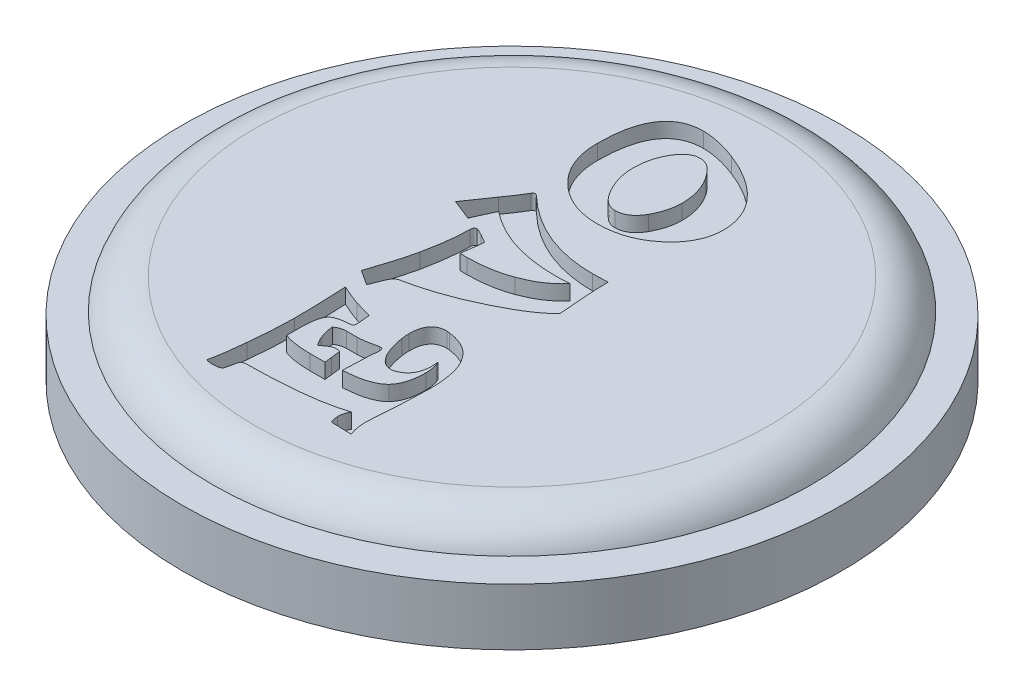
from build123d import *

# Parameters (mm, degrees)
SKETCH1_R           = 17.3
BOSS_EXTRUDE1_DEPTH = 4
SKETCH2_R           = 20
BOSS_EXTRUDE2_DEPTH = 2
CHAMFER1_SIZE       = 0.5
CHAMFER1_SIZE2      = 1.37373871
SKETCH4_R           = 21
SKETCH4_R_2         = 17.8
BOSS_EXTRUDE4_DEPTH = 3.6
FILLET1_R           = 3
CUT_EXTRUDE1_START  = -1
CUT_EXTRUDE1_DEPTH  = 1
BOSS_EXTRUDE5_START = 0.2
SKETCH5_R           = 22
SKETCH5_R_2         = 18.3
BOSS_EXTRUDE5_DEPTH = 3.8


# Read off the part's stored shape, not the designer's step: Cut-Extrude1
with BuildPart() as part:
    # Sketch1 → Boss-Extrude1 (new body)
    with BuildSketch(Plane(origin=(0, 0, 0), x_dir=(1, 0, 0), z_dir=(0, 1, 0))):
        with Locations(Location((0, 0, 0), (0, 0, 270))):
            Circle(SKETCH1_R)
    extrude(amount=BOSS_EXTRUDE1_DEPTH)

    # Sketch2 → Boss-Extrude2 (add)
    with BuildSketch(Plane(origin=(0, 4, 0), x_dir=(1, 0, 0), z_dir=(0, 1, 0))):
        with Locations(Location((0, 0, 0), (0, 0, 270))):
            Circle(SKETCH2_R)
    extrude(amount=BOSS_EXTRUDE2_DEPTH)

    # Chamfer1
    chamfer1_edges = [part.edges().sort_by_distance(p)[0] for p in [
        (0, 0, -17.3),
    ]]
    chamfer1_side = [part.faces().sort_by_distance(p)[0] for p in [
        (0, 0, 0),
    ]]
    chamfer(chamfer1_edges, length=CHAMFER1_SIZE, length2=CHAMFER1_SIZE2, reference=chamfer1_side[0])

    # Fillet1
    # the kernel refuses this fillet: 3 mm, written as the material it takes off along each edge
    with BuildSketch(Plane(origin=(0, 6, 0), x_dir=(0, 0, 1), z_dir=(-1, 0, 0))) as fillet1_piece_1:
        with BuildLine():
            CenterArc((17.171572875, -3), FILLET1_R, 19.471220634, 70.528779366)
            Line((17.171572875, 0), (17.171572875, 0.06))
            Line((17.171572875, 0.06), (20, 0.06))
            Line((20, 0.06), (20.06, 0))
            ThreePointArc((20.06, 0), (20.06, -1), (20.056568542, -1.98))
            Line((20.056568542, -1.98), (20, -2))
        make_face()
    revolve(axis=Axis((0, 6, 0), (0, 1, 0)), mode=Mode.SUBTRACT)

    # Cut-Extrude1 outline → Cut-Extrude1 (cut)
    # profile 1 of 3: a face of its own
    with BuildSketch(Plane(origin=(0, 6, 0), x_dir=(1, 0, 0), z_dir=(0, 1, 0)).offset(CUT_EXTRUDE1_START)):
        with BuildLine():
            add(Edge.make_bspline(
                [(-0.168122271, -6.697598253), (-0.167145866, -6.640798599), (-0.165256065, -6.530864577), (-0.151681763, -6.371256134), (-0.131732502, -6.222672194), (-0.099932248, -6.085438859), (-0.060747783, -5.958916209), (-0.014054684, -5.841952862), (0.043667016, -5.736769087), (0.109360202, -5.642700498), (0.183439681, -5.559323391), (0.268191549, -5.489129841), (0.360244475, -5.427197194), (0.462837416, -5.378891365), (0.572833112, -5.338959273), (0.691574959, -5.311560647), (0.818833935, -5.294748275), (0.906603543, -5.293316432), (0.951965066, -5.292576419)],
                knots=[0, 0, 0, 0, 0.082956343, 0.160559504, 0.233852757, 0.301742576, 0.366049731, 0.427199969, 0.485361024, 0.540882594, 0.59451718, 0.647705424, 0.70122135, 0.756138499, 0.812883208, 0.871869129, 0.93377877, 1, 1, 1, 1], degree=3))
            add(Edge.make_bspline(
                [(-0.122270742, -7.229803493), (-0.129038192, -7.179613365), (-0.142040315, -7.083184387), (-0.157223838, -6.944565918), (-0.16560783, -6.817242327), (-0.167307576, -6.736363682), (-0.168122271, -6.697598253)],
                knots=[0, 0, 0, 0, 0.284211338, 0.546047788, 0.782419057, 1, 1, 1, 1], degree=3))
            add(Edge.make_bspline(
                [(0.408296943, -8.816593886), (0.377348289, -8.76743983), (0.313857782, -8.666601326), (0.234105026, -8.501233866), (0.155470952, -8.324694831), (0.088647454, -8.132193498), (0.023200794, -7.927540165), (-0.030699199, -7.707122306), (-0.082786019, -7.473832669), (-0.108908575, -7.312386283), (-0.122270742, -7.229803493)],
                knots=[0, 0, 0, 0, 0.103337097, 0.211993862, 0.326462617, 0.447274087, 0.574531525, 0.708886835, 0.851090274, 1, 1, 1, 1], degree=3))
            add(Edge.make_bspline(
                [(1.263100437, -9.379912664), (1.223046302, -9.378698015), (1.143027908, -9.376271442), (1.026374232, -9.345338752), (0.911398308, -9.304444161), (0.803297215, -9.239586596), (0.696600878, -9.160827738), (0.596940008, -9.061121355), (0.49622725, -8.948162378), (0.438377123, -8.861602304), (0.408296943, -8.816593886)],
                knots=[0, 0, 0, 0, 0.112082108, 0.223912722, 0.336860261, 0.453517341, 0.576059942, 0.70822002, 0.848283921, 1, 1, 1, 1], degree=3))
            add(Edge.make_bspline(
                [(1.584061135, -9.319323144), (1.532149316, -9.337199486), (1.428115859, -9.373024424), (1.318179485, -9.377613499), (1.263100437, -9.379912664)],
                knots=[0, 0, 0, 0, 0.49899158, 1, 1, 1, 1], degree=3))
            add(Edge.make_bspline(
                [(2.478165939, -7.834061135), (2.475271751, -7.92427587), (2.469714149, -8.097511862), (2.429292488, -8.346226212), (2.359022101, -8.570051535), (2.26185114, -8.771194318), (2.13360973, -8.946759667), (1.978328467, -9.099322187), (1.793150515, -9.225861053), (1.655038502, -9.287596554), (1.584061135, -9.319323144)],
                knots=[0, 0, 0, 0, 0.145852043, 0.28007424, 0.405970352, 0.523996811, 0.63963609, 0.755729221, 0.874466411, 1, 1, 1, 1], degree=3))
            add(Edge.make_bspline(
                [(2.454683066, -7.39231115), (2.45485776, -7.396548593), (2.45716925, -7.449422225), (2.465355283, -7.5529269), (2.475942016, -7.695816994), (2.477463178, -7.790375932), (2.478165939, -7.834061135)],
                knots=[0.174865959, 0.174865959, 0.174865959, 0.174865959, 0.198596851, 0.47101008, 0.755612394, 1, 1, 1, 1], degree=3))
            add(Edge.make_bspline(
                [(2.522379913, -7.568777293), (2.50772928, -7.52695538), (2.486825707, -7.467283735), (2.462054932, -7.409671452), (2.454683066, -7.39231115)],
                knots=[0, 0, 0, 0, 0.423491781, 0.604239487, 0.604239487, 0.604239487, 0.604239487], degree=3))
            add(Edge.make_bspline(
                [(2.661572052, -8.392467249), (2.660156561, -8.320331922), (2.657358782, -8.177753343), (2.630387516, -7.967847339), (2.586439245, -7.764505632), (2.543712984, -7.633958845), (2.522379913, -7.568777293)],
                knots=[0, 0, 0, 0, 0.25769841, 0.509351998, 0.755021177, 1, 1, 1, 1], degree=3))
            add(Edge.make_bspline(
                [(2.088427948, -10.311681223), (2.134775907, -10.26052271), (2.229495009, -10.155972512), (2.344522612, -9.971291046), (2.442648108, -9.764950766), (2.525242946, -9.536005508), (2.586157715, -9.282689832), (2.62915543, -9.006627768), (2.658304004, -8.707496674), (2.660455756, -8.500074678), (2.661572052, -8.392467249)],
                knots=[0, 0, 0, 0, 0.100759314, 0.205916975, 0.316572784, 0.434463163, 0.561052278, 0.696848543, 0.842729559, 1, 1, 1, 1], degree=3))
            add(Edge.make_bspline(
                [(-0.272925764, -11.056768559), (-0.134143662, -11.047382028), (0.132671971, -11.029335945), (0.515037976, -10.978868949), (0.862616465, -10.909899429), (1.17669635, -10.828552707), (1.456090239, -10.726918208), (1.700761244, -10.608106033), (1.913351042, -10.472855719), (2.031403008, -10.364177958), (2.088427948, -10.311681223)],
                knots=[0, 0, 0, 0, 0.165116286, 0.317444438, 0.457503003, 0.585618724, 0.702278207, 0.80980511, 0.908126459, 1, 1, 1, 1], degree=3))
            add(Edge.make_bspline(
                [(-0.243449782, -10.265829694), (-0.246345684, -10.345518068), (-0.251800024, -10.4956086), (-0.256980671, -10.706944088), (-0.266279495, -10.890811103), (-0.270827041, -11.004363417), (-0.272925764, -11.056768559)],
                knots=[0, 0, 0, 0, 0.302240356, 0.569260153, 0.801210717, 1, 1, 1, 1], degree=3))
            add(Edge.make_bspline(
                [(-0.156659389, -8.723253275), (-0.161121714, -8.764727736), (-0.170743741, -8.854158337), (-0.184076523, -8.998223627), (-0.194715651, -9.162092932), (-0.20684063, -9.345434493), (-0.215864354, -9.54802558), (-0.225855467, -9.770177133), (-0.236015387, -10.011416805), (-0.240913417, -10.179032593), (-0.243449782, -10.265829694)],
                knots=[0, 0, 0, 0, 0.080976906, 0.174608983, 0.2808314, 0.399741668, 0.53128967, 0.674481103, 0.831435348, 1, 1, 1, 1], degree=3))
            add(Edge.make_bspline(
                [(-0.200873362, -8.492358079), (-0.193144928, -8.504623094), (-0.175692495, -8.532320086), (-0.162803116, -8.585558357), (-0.157149271, -8.65048197), (-0.156832251, -8.697574887), (-0.156659389, -8.723253275)],
                knots=[0, 0, 0, 0, 0.181110029, 0.408984633, 0.677736644, 1, 1, 1, 1], degree=3))
            add(Edge.make_bspline(
                [(-0.417030568, -8.443231441), (-0.396907572, -8.440319925), (-0.357790188, -8.434660188), (-0.299482362, -8.438446714), (-0.246497987, -8.45972263), (-0.216293328, -8.481328125), (-0.200873362, -8.492358079)],
                knots=[0, 0, 0, 0, 0.265341691, 0.515801582, 0.752808894, 1, 1, 1, 1], degree=3))
            add(Edge.make_bspline(
                [(-1.702510917, -8.64628821), (-1.667008335, -8.645605569), (-1.59097397, -8.644143586), (-1.469310077, -8.632751774), (-1.331433019, -8.619209446), (-1.178371913, -8.594610181), (-1.009250795, -8.568155185), (-0.825804884, -8.530323949), (-0.626221872, -8.490501121), (-0.488471329, -8.459374473), (-0.417030568, -8.443231441)],
                knots=[0, 0, 0, 0, 0.081693691, 0.174959891, 0.281087291, 0.400475556, 0.531617942, 0.675004537, 0.831449496, 1, 1, 1, 1], degree=3))
            Line((-1.702510917, -8.64628821), (-2.396834061, -8.64628821))
            add(Edge.make_bspline(
                [(-3.102620087, -8.880458515), (-3.049199401, -8.84394205), (-2.943904366, -8.77196614), (-2.767244067, -8.701853377), (-2.584941842, -8.654259853), (-2.459916999, -8.648961542), (-2.396834061, -8.64628821)],
                knots=[0, 0, 0, 0, 0.256058271, 0.504704577, 0.750092143, 1, 1, 1, 1], degree=3))
            add(Edge.make_bspline(
                [(-2.85371179, -9.905567686), (-2.889535513, -9.817119534), (-2.95915165, -9.645238497), (-3.037286106, -9.384824427), (-3.085973289, -9.130529668), (-3.097157353, -8.962520685), (-3.102620087, -8.880458515)],
                knots=[0, 0, 0, 0, 0.269742193, 0.52418922, 0.767595374, 1, 1, 1, 1], degree=3))
            add(Edge.make_bspline(
                [(-2.554039301, -10.427947598), (-2.585323125, -10.379475932), (-2.64503538, -10.286956792), (-2.728039406, -10.152500234), (-2.797186323, -10.026890251), (-2.835560821, -9.944525738), (-2.85371179, -9.905567686)],
                knots=[0, 0, 0, 0, 0.287070929, 0.54793981, 0.786177513, 1, 1, 1, 1], degree=3))
            add(Edge.make_bspline(
                [(-2.147925764, -10.1430131), (-2.175677322, -10.164954859), (-2.234342857, -10.211338743), (-2.328810188, -10.282295702), (-2.437864814, -10.353335326), (-2.514166418, -10.402339511), (-2.554039301, -10.427947598)],
                knots=[0, 0, 0, 0, 0.213798386, 0.451960098, 0.713611122, 1, 1, 1, 1], degree=3))
            add(Edge.make_bspline(
                [(-1.7319869, -10.008733624), (-1.769260634, -10.01020973), (-1.842469171, -10.013108917), (-1.950214214, -10.039366758), (-2.053551221, -10.081046091), (-2.116321011, -10.12226119), (-2.147925764, -10.1430131)],
                knots=[0, 0, 0, 0, 0.251425517, 0.493819431, 0.745136761, 1, 1, 1, 1], degree=3))
            add(Edge.make_bspline(
                [(-1.455240175, -10.04639738), (-1.500340551, -10.035615871), (-1.591332326, -10.013863756), (-1.684831103, -10.01045355), (-1.7319869, -10.008733624)],
                knots=[0, 0, 0, 0, 0.495653333, 1, 1, 1, 1], degree=3))
            add(Edge.make_bspline(
                [(-1.378275109, -10.686681223), (-1.383720758, -10.637007391), (-1.393896056, -10.544190892), (-1.408273032, -10.414781575), (-1.42230245, -10.305232919), (-1.430888441, -10.214899827), (-1.441003611, -10.144618842), (-1.448921445, -10.094660901), (-1.449881739, -10.063454866), (-1.454046149, -10.050198317), (-1.455240175, -10.04639738)],
                knots=[0, 0, 0, 0, 0.23239877, 0.434241519, 0.605532592, 0.745981242, 0.856196465, 0.935543954, 0.981519069, 1, 1, 1, 1], degree=3))
            add(Edge.make_bspline(
                [(-1.320960699, -11.161572052), (-1.32612523, -11.128308422), (-1.337024565, -11.058108151), (-1.34904689, -10.945375975), (-1.364374961, -10.820510329), (-1.373510958, -10.732549946), (-1.378275109, -10.686681223)],
                knots=[0, 0, 0, 0, 0.211068548, 0.445443539, 0.710815298, 1, 1, 1, 1], degree=3))
            Line((-1.320960699, -11.161572052), (-2.306768559, -11.161572052))
            add(Edge.make_bspline(
                [(-4.150655022, -10.889737991), (-4.090870967, -10.911802358), (-3.967690057, -10.95726446), (-3.772796547, -11.012081789), (-3.56329912, -11.058002185), (-3.339541896, -11.094438449), (-3.101625613, -11.126519896), (-2.849667439, -11.147239062), (-2.583066289, -11.158081423), (-2.400664471, -11.160385811), (-2.306768559, -11.161572052)],
                knots=[0, 0, 0, 0, 0.101982491, 0.210127872, 0.323767928, 0.445156351, 0.572943123, 0.70798975, 0.849680399, 1, 1, 1, 1], degree=3))
            Line((-4.150655022, -10.889737991), (-4.150655022, -9.966157205))
            add(Edge.make_bspline(
                [(-3.708515284, -8.356441048), (-3.744405283, -8.38327627), (-3.820102152, -8.439875386), (-3.909426416, -8.563881034), (-3.986073031, -8.716883578), (-4.044653805, -8.904247663), (-4.094023316, -9.122570563), (-4.126016539, -9.374791267), (-4.148036717, -9.659540302), (-4.14975031, -9.860210843), (-4.150655022, -9.966157205)],
                knots=[0, 0, 0, 0, 0.077522177, 0.163504766, 0.26239202, 0.374329567, 0.503717391, 0.65121565, 0.815855217, 1, 1, 1, 1], degree=3))
            add(Edge.make_bspline(
                [(-2.627729258, -8.120633188), (-2.689987618, -8.124572315), (-2.809761572, -8.132150491), (-2.981887546, -8.149916854), (-3.139017959, -8.173376984), (-3.282212705, -8.197993377), (-3.409777701, -8.231519147), (-3.523388618, -8.266826481), (-3.622733784, -8.306825637), (-3.680996587, -8.340524429), (-3.708515284, -8.356441048)],
                knots=[0, 0, 0, 0, 0.167700302, 0.322625398, 0.464990393, 0.59479928, 0.712962893, 0.819238844, 0.914622862, 1, 1, 1, 1], degree=3))
            add(Edge.make_bspline(
                [(-2.473799127, -7.897925764), (-2.47545426, -7.927597849), (-2.478461491, -7.981509397), (-2.505301097, -8.054726781), (-2.559685468, -8.103683674), (-2.604518778, -8.114851524), (-2.627729258, -8.120633188)],
                knots=[0, 0, 0, 0, 0.297870881, 0.541204988, 0.762479002, 1, 1, 1, 1], degree=3))
            add(Edge.make_bspline(
                [(-2.5, -7.52128821), (-2.496011613, -7.558390256), (-2.488452279, -7.628711098), (-2.480295002, -7.728627867), (-2.474937412, -7.817081316), (-2.474160436, -7.872264505), (-2.473799127, -7.897925764)],
                knots=[0, 0, 0, 0, 0.296366899, 0.561714822, 0.796188848, 1, 1, 1, 1], degree=3))
            add(Edge.make_bspline(
                [(-2.547489083, -6.997270742), (-2.53981383, -7.080783004), (-2.523762282, -7.25543538), (-2.508148075, -7.430127405), (-2.5, -7.52128821)],
                knots=[0, 0, 0, 0, 0.478162761, 1, 1, 1, 1], degree=3))
            add(Edge.make_bspline(
                [(-3.70360262, -6.656659389), (-3.512473543, -6.712061143), (-3.126605341, -6.82391108), (-2.741728095, -6.939124888), (-2.547489083, -6.997270742)],
                knots=[0, 0, 0, 0, 0.495322174, 1, 1, 1, 1], degree=3))
            add(Edge.make_bspline(
                [(-4.989082969, -6.131004367), (-4.880725484, -6.181273981), (-4.666317314, -6.28074303), (-4.342969672, -6.418164435), (-4.023316426, -6.54474187), (-3.809208817, -6.619691378), (-3.70360262, -6.656659389)],
                knots=[0, 0, 0, 0, 0.257881777, 0.510273559, 0.75844788, 1, 1, 1, 1], degree=3))
            add(Edge.make_bspline(
                [(-4.884279476, -9.620633188), (-4.884615785, -9.502181876), (-4.885310128, -9.257627937), (-4.890529415, -8.879342494), (-4.8987278, -8.478133198), (-4.910323166, -8.053455809), (-4.925032653, -7.605849539), (-4.943224923, -7.134780644), (-4.964403281, -6.640774577), (-4.980732557, -6.303485939), (-4.989082969, -6.131004367)],
                knots=[0, 0, 0, 0, 0.101775742, 0.210125647, 0.325056449, 0.44657379, 0.575151193, 0.709855221, 0.851626702, 1, 1, 1, 1], degree=3))
            add(Edge.make_bspline(
                [(-5.06768559, -12.609170306), (-5.053325467, -12.462352953), (-5.025254885, -12.175360364), (-4.986898965, -11.754047363), (-4.956506142, -11.351636256), (-4.929398415, -10.968519649), (-4.91033711, -10.604343894), (-4.89484518, -10.259387918), (-4.886778791, -9.933444567), (-4.885095061, -9.722710813), (-4.884279476, -9.620633188)],
                knots=[0, 0, 0, 0, 0.147748247, 0.288812264, 0.423701562, 0.551928594, 0.673473677, 0.788932743, 0.897760829, 1, 1, 1, 1], degree=3))
            add(Edge.make_bspline(
                [(-5.408296943, -14.950873362), (-5.394249863, -14.8958363), (-5.363098036, -14.773782109), (-5.321746782, -14.571534825), (-5.279093066, -14.332943447), (-5.237130929, -14.058218899), (-5.194772035, -13.747020464), (-5.15235668, -13.399808836), (-5.110274978, -13.016491001), (-5.082297946, -12.748921435), (-5.06768559, -12.609170306)],
                knots=[0, 0, 0, 0, 0.071942047, 0.159543913, 0.26140039, 0.378943642, 0.511539826, 0.659221437, 0.822011935, 1, 1, 1, 1], degree=3))
            add(Edge.make_bspline(
                [(-4.971069869, -15.03930131), (-5.017049869, -15.038974893), (-5.102873193, -15.038365623), (-5.221311756, -15.018299188), (-5.324132204, -14.995781559), (-5.381467794, -14.965188725), (-5.408296943, -14.950873362)],
                knots=[0, 0, 0, 0, 0.30518968, 0.569647525, 0.798624364, 1, 1, 1, 1], degree=3))
            add(Edge.make_bspline(
                [(-4.368449782, -14.862445415), (-4.378738301, -14.876690616), (-4.400470101, -14.90677987), (-4.448366443, -14.941851843), (-4.505906851, -14.973423396), (-4.57643755, -14.997267476), (-4.658017573, -15.016938356), (-4.751900415, -15.029026007), (-4.857381372, -15.037393587), (-4.931748346, -15.038641484), (-4.971069869, -15.03930131)],
                knots=[0, 0, 0, 0, 0.080593389, 0.170232413, 0.270483497, 0.382751211, 0.512191125, 0.657084392, 0.818683439, 1, 1, 1, 1], degree=3))
            add(Edge.make_bspline(
                [(-4.203056769, -14.122270742), (-4.211905854, -14.174755628), (-4.230688718, -14.286158832), (-4.269821361, -14.461586663), (-4.315147374, -14.656053362), (-4.350142079, -14.791556227), (-4.368449782, -14.862445415)],
                knots=[0, 0, 0, 0, 0.210428207, 0.446650047, 0.710511441, 1, 1, 1, 1], degree=3))
            add(Edge.make_bspline(
                [(-3.805131004, -13.886462882), (-3.852495158, -13.889430642), (-3.94039347, -13.894938205), (-4.059701575, -13.93955157), (-4.151618971, -14.01736653), (-4.185674357, -14.086820388), (-4.203056769, -14.122270742)],
                knots=[0, 0, 0, 0, 0.287509923, 0.533560406, 0.761921812, 1, 1, 1, 1], degree=3))
            add(Edge.make_bspline(
                [(2.451965066, -13.152838428), (2.363764218, -13.181968837), (2.183491124, -13.241508275), (1.901520126, -13.318789745), (1.603916828, -13.395223545), (1.287878519, -13.46284734), (0.955373918, -13.526646079), (0.606630008, -13.586086775), (0.240494563, -13.637179186), (-0.141919639, -13.687532411), (-0.541839726, -13.728459331), (-0.958136319, -13.769150276), (-1.39119305, -13.800792265), (-1.841535591, -13.828801756), (-2.308250081, -13.85213504), (-2.792532499, -13.867152097), (-3.293046176, -13.881690958), (-3.632631005, -13.88485542), (-3.805131004, -13.886462882)],
                knots=[0, 0, 0, 0, 0.044062506, 0.090059047, 0.138674895, 0.189827127, 0.243360715, 0.299304977, 0.357648248, 0.418744688, 0.482292622, 0.548365575, 0.617189454, 0.688285388, 0.762441278, 0.838883148, 0.918156954, 1, 1, 1, 1], degree=3))
            add(Edge.make_bspline(
                [(2.242358079, -13.886462882), (2.24465245, -13.815830323), (2.249084412, -13.679391732), (2.289254053, -13.484581045), (2.35348168, -13.3067572), (2.419434146, -13.203680701), (2.451965066, -13.152838428)],
                knots=[0, 0, 0, 0, 0.273114502, 0.5275663, 0.766973042, 1, 1, 1, 1], degree=3))
            add(Edge.make_bspline(
                [(2.352074236, -14.40720524), (2.335346492, -14.364928123), (2.302187115, -14.281122271), (2.268523833, -14.150878431), (2.245653607, -14.019368583), (2.243456811, -13.930773768), (2.242358079, -13.886462882)],
                knots=[0, 0, 0, 0, 0.254400823, 0.504298293, 0.752073731, 1, 1, 1, 1], degree=3))
            Line((2.352074236, -14.40720524), (3.709606987, -14.448144105))
            add(Edge.make_bspline(
                [(3.5, -13.283842795), (3.502472258, -13.383871708), (3.507395426, -13.583065722), (3.548445574, -13.878366017), (3.612413779, -14.168318181), (3.677185444, -14.354800254), (3.709606987, -14.448144105)],
                knots=[0, 0, 0, 0, 0.252257289, 0.50233618, 0.75089371, 1, 1, 1, 1], degree=3))
            add(Edge.make_bspline(
                [(3.55731441, -12.299672489), (3.548847822, -12.403364961), (3.533123853, -12.595940432), (3.515309111, -12.863426312), (3.502136798, -13.087751939), (3.500660393, -13.223239443), (3.5, -13.283842795)],
                knots=[0, 0, 0, 0, 0.316513234, 0.587821702, 0.815633281, 1, 1, 1, 1], degree=3))
            add(Edge.make_bspline(
                [(3.637554585, -11.218886463), (3.635818133, -11.247265044), (3.632078911, -11.308374622), (3.628257667, -11.407304615), (3.61853627, -11.520129477), (3.611760665, -11.648032275), (3.599448611, -11.790404347), (3.585974733, -11.947532029), (3.574000554, -12.119111105), (3.563012707, -12.238011012), (3.55731441, -12.299672489)],
                knots=[0, 0, 0, 0, 0.078696835, 0.169463381, 0.273988029, 0.3920792, 0.523951279, 0.669499317, 0.828602387, 1, 1, 1, 1], degree=3))
            add(Edge.make_bspline(
                [(3.709606987, -9.207969432), (3.709093215, -9.236354433), (3.70777905, -9.308959831), (3.704227342, -9.441595783), (3.699829871, -9.621215345), (3.690639493, -9.848785161), (3.681733768, -10.123948045), (3.667777523, -10.447039102), (3.653323306, -10.817137212), (3.643017893, -11.079694472), (3.637554585, -11.218886463)],
                knots=[0, 0, 0, 0, 0.042325197, 0.108262735, 0.19781354, 0.310191027, 0.447809139, 0.608259015, 0.792322606, 1, 1, 1, 1], degree=3))
            add(Edge.make_bspline(
                [(3.252729258, -6.71069869), (3.289497991, -6.78710739), (3.365376966, -6.944790654), (3.457374775, -7.199939451), (3.536225666, -7.47788195), (3.598526948, -7.779129445), (3.649873463, -8.103081287), (3.684936582, -8.450777465), (3.706464994, -8.821774994), (3.708540911, -9.07693398), (3.709606987, -9.207969432)],
                knots=[0, 0, 0, 0, 0.099262295, 0.20484582, 0.317165247, 0.437414459, 0.564911332, 0.701176089, 0.846540673, 1, 1, 1, 1], degree=3))
            add(Edge.make_bspline(
                [(1.137008734, -5.312227074), (1.255397839, -5.328744469), (1.486533957, -5.360992086), (1.81773433, -5.451775176), (2.123018631, -5.576532397), (2.402990974, -5.735051284), (2.65741362, -5.9279047), (2.884192803, -6.156329317), (3.087138435, -6.41717794), (3.196733688, -6.611442818), (3.252729258, -6.71069869)],
                knots=[0, 0, 0, 0, 0.135214343, 0.26398475, 0.387572829, 0.507676115, 0.627186593, 0.747783242, 0.871134738, 1, 1, 1, 1], degree=3))
            add(Edge.make_bspline(
                [(0.951965066, -5.292576419), (0.990354285, -5.293276635), (1.052691041, -5.294413652), (1.113607012, -5.307283097), (1.137008734, -5.312227074)],
                knots=[0, 0, 0, 0, 0.615836024, 1, 1, 1, 1], degree=3))
        make_face()
    # profile 2 of 3: a face of its own
    with BuildSketch(Plane(origin=(0, 6, 0), x_dir=(1, 0, 0), z_dir=(0, 1, 0)).offset(CUT_EXTRUDE1_START)):
        with BuildLine():
            add(Edge.make_bspline(
                [(-4.884279476, 10.603165939), (-4.882081622, 10.774070856), (-4.877829083, 11.104747826), (-4.845174049, 11.584190245), (-4.790542154, 12.030526352), (-4.712278707, 12.444111649), (-4.612934722, 12.825209673), (-4.493139069, 13.174019795), (-4.34816433, 13.489353925), (-4.182038689, 13.772846), (-3.990629374, 14.022078669), (-3.778217709, 14.238801514), (-3.543443587, 14.422628986), (-3.285958484, 14.573329631), (-3.004639343, 14.687179188), (-2.702797507, 14.771621993), (-2.37824665, 14.820771996), (-2.15464305, 14.826667585), (-2.039847162, 14.829694323)],
                knots=[0, 0, 0, 0, 0.088702264, 0.171626401, 0.249289977, 0.321971017, 0.389936058, 0.453554526, 0.513136613, 0.569792707, 0.623741001, 0.675830837, 0.726895823, 0.778064454, 0.830152748, 0.883976656, 0.940434757, 1, 1, 1, 1], degree=3))
            add(Edge.make_bspline(
                [(-3.408842795, 7.134825328), (-3.469000917, 7.190926433), (-3.588477726, 7.302345819), (-3.754665994, 7.479925719), (-3.911834284, 7.661863061), (-4.054985733, 7.85193374), (-4.188489394, 8.047145648), (-4.309808004, 8.248936726), (-4.419305844, 8.456868863), (-4.51795367, 8.670473692), (-4.605367833, 8.889913763), (-4.678190903, 9.116917486), (-4.742529689, 9.34943677), (-4.795252029, 9.588200924), (-4.833472632, 9.833383677), (-4.864113221, 10.083949955), (-4.879661853, 10.341507332), (-4.882728288, 10.515267533), (-4.884279476, 10.603165939)],
                knots=[0, 0, 0, 0, 0.063447229, 0.126009128, 0.187539096, 0.248858279, 0.309482234, 0.369934801, 0.430406434, 0.490704775, 0.551391598, 0.612521035, 0.674537663, 0.737483935, 0.801042882, 0.865921973, 0.932175234, 1, 1, 1, 1], degree=3))
            add(Edge.make_bspline(
                [(-0.243449782, 5.92139738), (-0.393175152, 5.925380448), (-0.688755092, 5.933243613), (-1.124290281, 5.989416228), (-1.544143251, 6.084849199), (-1.948754073, 6.218110904), (-2.339268666, 6.388685414), (-2.712696279, 6.600628847), (-3.074887021, 6.845054645), (-3.296629434, 7.037458716), (-3.408842795, 7.134825328)],
                knots=[0, 0, 0, 0, 0.129392202, 0.255439272, 0.378816374, 0.50100429, 0.623108382, 0.746466541, 0.871698692, 1, 1, 1, 1], degree=3))
            add(Edge.make_bspline(
                [(3.023471616, 7.095524017), (2.909429392, 7.001599134), (2.683011616, 6.815122032), (2.315523739, 6.576058346), (1.930861361, 6.374109616), (1.529920435, 6.207647246), (1.110843321, 6.079390483), (0.674509058, 5.988761061), (0.220984805, 5.930893911), (-0.087159297, 5.924593131), (-0.243449782, 5.92139738)],
                knots=[0, 0, 0, 0, 0.124807229, 0.247790462, 0.369765548, 0.491611409, 0.614208876, 0.739632071, 0.867941558, 1, 1, 1, 1], degree=3))
            add(Edge.make_bspline(
                [(4.338427948, 9.756550218), (4.334126088, 9.631863178), (4.325603264, 9.3848338), (4.26375231, 9.020099975), (4.15965436, 8.667552424), (4.014867436, 8.326698567), (3.827221139, 7.998580982), (3.600267496, 7.681927989), (3.331973861, 7.376785105), (3.127964969, 7.190790469), (3.023471616, 7.095524017)],
                knots=[0, 0, 0, 0, 0.121991111, 0.241688216, 0.360853717, 0.481006478, 0.603251117, 0.72999171, 0.861701755, 1, 1, 1, 1], degree=3))
            add(Edge.make_bspline(
                [(2.962882096, 12.746724891), (3.072472335, 12.640608288), (3.287108278, 12.432775571), (3.568398795, 12.09337193), (3.806072101, 11.739509908), (4.000805929, 11.370758619), (4.15212993, 10.987367477), (4.26100833, 10.590058192), (4.326479278, 10.177944665), (4.334412529, 9.898162221), (4.338427948, 9.756550218)],
                knots=[0, 0, 0, 0, 0.134820004, 0.264049234, 0.388954805, 0.511162868, 0.632080071, 0.752692444, 0.874825176, 1, 1, 1, 1], degree=3))
            add(Edge.make_bspline(
                [(0.372270742, 14.292576419), (0.499341131, 14.242306823), (0.750682951, 14.142874911), (1.115281387, 13.977582587), (1.463656478, 13.800105363), (1.795716193, 13.611921668), (2.112758863, 13.413999021), (2.412657189, 13.203930357), (2.697241289, 12.983539228), (2.874778309, 12.825267944), (2.962882096, 12.746724891)],
                knots=[0, 0, 0, 0, 0.135081942, 0.267188458, 0.395581358, 0.52148469, 0.644410743, 0.764924006, 0.88334216, 1, 1, 1, 1], degree=3))
            add(Edge.make_bspline(
                [(-2.039847162, 14.829694323), (-1.954100399, 14.827989183), (-1.777911852, 14.824485538), (-1.507702169, 14.799130955), (-1.224831728, 14.755446693), (-0.929199224, 14.696604624), (-0.621162412, 14.620817716), (-0.300523022, 14.528494132), (0.032635242, 14.419108944), (0.257372516, 14.3353822), (0.372270742, 14.292576419)],
                knots=[0, 0, 0, 0, 0.103544943, 0.212759439, 0.327427791, 0.449077845, 0.576660901, 0.710398053, 0.851939335, 1, 1, 1, 1], degree=3))
        make_face()
        with BuildLine():
            add(Edge.make_bspline(
                [(0.739082969, 12.186681223), (0.68723331, 12.262801685), (0.587759891, 12.408838568), (0.426904323, 12.606715716), (0.263614213, 12.773977503), (0.099353923, 12.912941788), (-0.068728572, 13.018433908), (-0.237917386, 13.095686033), (-0.409944831, 13.14450557), (-0.526444853, 13.150081028), (-0.584061135, 13.152838428)],
                knots=[0, 0, 0, 0, 0.161910728, 0.310625257, 0.447735295, 0.572477541, 0.688060975, 0.795463318, 0.898844284, 1, 1, 1, 1], degree=3))
            add(Edge.make_bspline(
                [(1.403930131, 9.959606987), (1.402175263, 10.060119892), (1.398695057, 10.259454379), (1.366783828, 10.555115931), (1.313503651, 10.844259399), (1.243477916, 11.127704094), (1.145545976, 11.402108991), (1.033960203, 11.672139889), (0.89742776, 11.934402394), (0.792097045, 12.102217889), (0.739082969, 12.186681223)],
                knots=[0, 0, 0, 0, 0.127837061, 0.253523017, 0.377740626, 0.501695937, 0.624455133, 0.74800522, 0.873168331, 1, 1, 1, 1], degree=3))
            add(Edge.make_bspline(
                [(0.929039301, 8.187772926), (0.96704709, 8.258835253), (1.042287098, 8.399509838), (1.138566767, 8.616356312), (1.221015855, 8.834917235), (1.288716582, 9.05571541), (1.338486113, 9.279368817), (1.377439036, 9.503780936), (1.398349523, 9.731045232), (1.402063362, 9.883150801), (1.403930131, 9.959606987)],
                knots=[0, 0, 0, 0, 0.130332825, 0.258006133, 0.383473976, 0.50805934, 0.631231616, 0.753899586, 0.876297106, 1, 1, 1, 1], degree=3))
            add(Edge.make_bspline(
                [(-0.417030568, 7.283842795), (-0.348563754, 7.28665672), (-0.214084811, 7.292183685), (-0.018115162, 7.336532912), (0.167299819, 7.407488644), (0.343014208, 7.507120208), (0.507397115, 7.636231996), (0.660150562, 7.794128194), (0.803720675, 7.978544467), (0.886283846, 8.116389618), (0.929039301, 8.187772926)],
                knots=[0, 0, 0, 0, 0.12029101, 0.236269327, 0.351422535, 0.468334453, 0.590064393, 0.717669425, 0.85379471, 1, 1, 1, 1], degree=3))
            add(Edge.make_bspline(
                [(-1.686135371, 8.266375546), (-1.639963324, 8.188557473), (-1.551931515, 8.040189225), (-1.404312491, 7.8397025), (-1.253665238, 7.668842187), (-1.096192555, 7.528716239), (-0.934415022, 7.418634361), (-0.76559575, 7.343085496), (-0.593668149, 7.291352308), (-0.475802165, 7.286341392), (-0.417030568, 7.283842795)],
                knots=[0, 0, 0, 0, 0.161242153, 0.307424932, 0.443204561, 0.566618423, 0.682414282, 0.790423267, 0.89549861, 1, 1, 1, 1], degree=3))
            add(Edge.make_bspline(
                [(-2.26419214, 10.300218341), (-2.261995181, 10.215556894), (-2.257591242, 10.045847834), (-2.231320834, 9.790625413), (-2.18452932, 9.536036442), (-2.122893975, 9.280661248), (-2.040247838, 9.026548968), (-1.939031711, 8.772528475), (-1.824631086, 8.516184011), (-1.73269131, 8.350349752), (-1.686135371, 8.266375546)],
                knots=[0, 0, 0, 0, 0.118801, 0.238143889, 0.359531141, 0.481758719, 0.606494473, 0.734068849, 0.865339302, 1, 1, 1, 1], degree=3))
            add(Edge.make_bspline(
                [(-1.761462882, 12.320960699), (-1.802042563, 12.250110765), (-1.883692024, 12.107555212), (-1.983549225, 11.880228794), (-2.071657913, 11.643917144), (-2.14124029, 11.395546244), (-2.197235792, 11.136984927), (-2.236274446, 10.867249356), (-2.259216114, 10.587192777), (-2.262516116, 10.39687698), (-2.26419214, 10.300218341)],
                knots=[0, 0, 0, 0, 0.116127796, 0.233658118, 0.35286336, 0.474833765, 0.600388354, 0.729151371, 0.8624399, 1, 1, 1, 1], degree=3))
            add(Edge.make_bspline(
                [(-0.584061135, 13.152838428), (-0.641094103, 13.150474746), (-0.753826074, 13.145802668), (-0.918558288, 13.103503951), (-1.078013928, 13.040235287), (-1.228841454, 12.946047825), (-1.375014777, 12.828784338), (-1.511439852, 12.682816414), (-1.643896811, 12.513401786), (-1.721250854, 12.386782805), (-1.761462882, 12.320960699)],
                knots=[0, 0, 0, 0, 0.112906097, 0.223171396, 0.335333055, 0.451915173, 0.574307253, 0.705991494, 0.84716147, 1, 1, 1, 1], degree=3))
        make_face(mode=Mode.SUBTRACT)
    # profile 3 of 3: a face of its own
    with BuildSketch(Plane(origin=(0, 6, 0), x_dir=(1, 0, 0), z_dir=(0, 1, 0)).offset(CUT_EXTRUDE1_START)):
        with BuildLine():
            add(Edge.make_bspline(
                [(-4.211244541, 5.482532751), (-4.190784182, 5.509904923), (-4.154036603, 5.559066377), (-4.076439162, 5.604713154), (-3.990120906, 5.59714153), (-3.944720159, 5.565455318), (-3.919759825, 5.548034934)],
                knots=[0, 0, 0, 0, 0.293932381, 0.527913652, 0.740457288, 1, 1, 1, 1], degree=3))
            add(Edge.make_bspline(
                [(-5.075873362, 4.172489083), (-4.99585561, 4.285799007), (-4.838984638, 4.507937685), (-4.613535807, 4.838817228), (-4.406163328, 5.162834216), (-4.275282806, 5.377499574), (-4.211244541, 5.482532751)],
                knots=[0, 0, 0, 0, 0.265047675, 0.519613274, 0.764952555, 1, 1, 1, 1], degree=3))
            add(Edge.make_bspline(
                [(-6.246724891, 2.480895197), (-6.17574156, 2.584045504), (-6.040213412, 2.780989916), (-5.846932462, 3.062616635), (-5.673299001, 3.316773113), (-5.518607479, 3.542823089), (-5.379593999, 3.739026226), (-5.263171903, 3.909657506), (-5.162612617, 4.050182946), (-5.10259623, 4.134808673), (-5.075873362, 4.172489083)],
                knots=[0, 0, 0, 0, 0.182589344, 0.348617, 0.498083269, 0.631438282, 0.748030687, 0.848713623, 0.9326383, 1, 1, 1, 1], degree=3))
            add(Edge.make_bspline(
                [(-4.881004367, 1.938864629), (-4.924170409, 1.954027478), (-5.015077447, 1.98596021), (-5.156250136, 2.038385573), (-5.310130222, 2.095525135), (-5.474296422, 2.161699296), (-5.651598192, 2.231543937), (-5.839814702, 2.308786533), (-6.039635434, 2.392222232), (-6.176356188, 2.450764249), (-6.246724891, 2.480895197)],
                knots=[0, 0, 0, 0, 0.093391697, 0.196681515, 0.30740294, 0.428447286, 0.557974491, 0.696402621, 0.84374169, 1, 1, 1, 1], degree=3))
            add(Edge.make_bspline(
                [(-4.530567686, 2.723253275), (-4.584578547, 2.597451142), (-4.697565736, 2.334281307), (-4.818092553, 2.074476089), (-4.881004367, 1.938864629)],
                knots=[0, 0, 0, 0, 0.478026419, 1, 1, 1, 1], degree=3))
            add(Edge.make_bspline(
                [(-4.232532751, 3.35371179), (-4.250629054, 3.317727095), (-4.292417349, 3.234630619), (-4.360600926, 3.093467138), (-4.440473756, 2.918653853), (-4.498865602, 2.792010466), (-4.530567686, 2.723253275)],
                knots=[0, 0, 0, 0, 0.17326388, 0.400103926, 0.674304598, 1, 1, 1, 1], degree=3))
            add(Edge.make_bspline(
                [(1.376091703, 1.519650655), (1.2368558, 1.520509733), (0.961462153, 1.522208898), (0.553125752, 1.547821587), (0.153476052, 1.579640877), (-0.236758671, 1.632244163), (-0.619133076, 1.694319812), (-0.991543394, 1.776334066), (-1.356814784, 1.866321789), (-1.711310901, 1.975646874), (-2.058580515, 2.095720949), (-2.394903572, 2.235048247), (-2.725477597, 2.382258381), (-3.044091749, 2.548930444), (-3.355733017, 2.727486403), (-3.656642677, 2.922801801), (-3.95232496, 3.127957107), (-4.13896613, 3.27832808), (-4.232532751, 3.35371179)],
                knots=[0, 0, 0, 0, 0.069340272, 0.137147603, 0.203733815, 0.268990051, 0.333221534, 0.396627701, 0.458877857, 0.520546376, 0.581340822, 0.641827459, 0.701817083, 0.761525088, 0.820845551, 0.88065252, 0.940168933, 1, 1, 1, 1], degree=3))
            add(Edge.make_bspline(
                [(2.303394509, 1.562924951), (2.268901483, 1.558428639), (2.156162888, 1.544795741), (1.951529554, 1.533392314), (1.677000987, 1.520373623), (1.480919581, 1.519902516), (1.376091703, 1.519650655)],
                knots=[0.090181309, 0.090181309, 0.090181309, 0.090181309, 0.192385139, 0.423915884, 0.692017327, 1, 1, 1, 1], degree=3))
            add(Edge.make_bspline(
                [(0.10371179, 0.093340611), (0.22283757, 0.138682925), (0.456347583, 0.227562798), (0.787780565, 0.385166636), (1.0999793, 0.549466072), (1.387543802, 0.730137184), (1.655302378, 0.921665382), (1.89790429, 1.12858185), (2.117428072, 1.338926253), (2.243534739, 1.490429203), (2.303394509, 1.562924951)],
                knots=[0, 0, 0, 0, 0.141555377, 0.277476444, 0.407433029, 0.533298202, 0.654484596, 0.772821242, 0.887322846, 0.991692174, 0.991692174, 0.991692174, 0.991692174], degree=3))
            add(Edge.make_bspline(
                [(-2.624454148, -0.366812227), (-2.502142007, -0.365879101), (-2.260022912, -0.364031962), (-1.90063563, -0.339424406), (-1.548865526, -0.303754365), (-1.203742481, -0.255598279), (-0.866462038, -0.188939968), (-0.535610879, -0.111086219), (-0.211871032, -0.018088803), (-0.00129245, 0.056264572), (0.10371179, 0.093340611)],
                knots=[0, 0, 0, 0, 0.131920492, 0.261139, 0.388399989, 0.513311157, 0.636877144, 0.759134203, 0.879893151, 1, 1, 1, 1], degree=3))
            add(Edge.make_bspline(
                [(-3.102237551, -0.35985153), (-3.035231484, -0.361995712), (-2.876011262, -0.366772329), (-2.716711904, -0.366797595), (-2.624454148, -0.366812227)],
                knots=[0.073777583, 0.073777583, 0.073777583, 0.073777583, 0.463581002, 1, 1, 1, 1], degree=3))
            add(Edge.make_bspline(
                [(-3.027292576, 0.253820961), (-3.03860873, 0.182914081), (-3.059123803, 0.054366876), (-3.081577669, -0.120442145), (-3.098003226, -0.25394446), (-3.101112124, -0.329937695), (-3.102237551, -0.35985153)],
                knots=[0, 0, 0, 0, 0.342520643, 0.620956272, 0.840955698, 0.983717111, 0.983717111, 0.983717111, 0.983717111], degree=3))
            add(Edge.make_bspline(
                [(-2.924126638, 1.095524017), (-2.92764253, 1.040915819), (-2.935353287, 0.921153731), (-2.955140883, 0.726050337), (-2.987123717, 0.500163129), (-3.013326791, 0.339468448), (-3.027292576, 0.253820961)],
                knots=[0, 0, 0, 0, 0.193474769, 0.424312525, 0.693168528, 1, 1, 1, 1], degree=3))
            add(Edge.make_bspline(
                [(-3.489082969, 1.418122271), (-3.425743404, 1.381040564), (-3.310050485, 1.313308953), (-3.1530962, 1.220763217), (-3.02786189, 1.150701734), (-2.95474308, 1.111809179), (-2.924126638, 1.095524017)],
                knots=[0, 0, 0, 0, 0.338418804, 0.618139059, 0.840106484, 1, 1, 1, 1], degree=3))
            add(Edge.make_bspline(
                [(-3.965611354, 1.624454148), (-3.941960578, 1.620795762), (-3.882043972, 1.611527649), (-3.779082433, 1.56975688), (-3.645019509, 1.502590948), (-3.545147706, 1.448491767), (-3.489082969, 1.418122271)],
                knots=[0, 0, 0, 0, 0.137192843, 0.347562789, 0.633743268, 1, 1, 1, 1], degree=3))
            add(Edge.make_bspline(
                [(-4.149017467, 1.359170306), (-4.147409157, 1.398192242), (-4.144557506, 1.467380998), (-4.112193665, 1.558353927), (-4.046928299, 1.617059137), (-3.993442751, 1.621923145), (-3.965611354, 1.624454148)],
                knots=[0, 0, 0, 0, 0.320495154, 0.568261423, 0.775343276, 1, 1, 1, 1], degree=3))
            add(Edge.make_bspline(
                [(-4.522379913, -1.632641921), (-4.471830508, -1.388004103), (-4.370579803, -0.897993362), (-4.263854761, -0.153147803), (-4.183823512, 0.599512774), (-4.160655519, 1.105164617), (-4.149017467, 1.359170306)],
                knots=[0, 0, 0, 0, 0.248180649, 0.497107049, 0.747380194, 1, 1, 1, 1], degree=3))
            add(Edge.make_bspline(
                [(-5.408296943, -4.645742358), (-5.358427671, -4.49788295), (-5.260839887, -4.208541007), (-5.121424694, -3.784265801), (-4.995306211, -3.378325975), (-4.879490067, -2.992268357), (-4.771389082, -2.625641079), (-4.679749994, -2.277133805), (-4.594391553, -1.949084975), (-4.545885311, -1.735932446), (-4.522379913, -1.632641921)],
                knots=[0, 0, 0, 0, 0.148986065, 0.291546666, 0.426384734, 0.554825481, 0.676382376, 0.791296841, 0.898865574, 1, 1, 1, 1], degree=3))
            Line((-5.408296943, -4.645742358), (-4.411026201, -5.292576419))
            add(Edge.make_bspline(
                [(-4.073689956, -4.429585153), (-4.125551712, -4.567350575), (-4.234375041, -4.856428557), (-4.350331121, -5.14272159), (-4.411026201, -5.292576419)],
                knots=[0, 0, 0, 0, 0.476568367, 1, 1, 1, 1], degree=3))
            add(Edge.make_bspline(
                [(-3.625, -3.92849345), (-3.644942273, -3.933723333), (-3.68644962, -3.944608681), (-3.745156269, -3.977218382), (-3.803413947, -4.020771722), (-3.861252628, -4.076989956), (-3.915865293, -4.147855728), (-3.969589734, -4.230520612), (-4.024855273, -4.324259007), (-4.056838516, -4.393240138), (-4.073689956, -4.429585153)],
                knots=[0, 0, 0, 0, 0.088637937, 0.184488788, 0.287154583, 0.402053098, 0.531132503, 0.672198209, 0.827286671, 1, 1, 1, 1], degree=3))
            add(Edge.make_bspline(
                [(0.909388646, -2.361353712), (0.717204882, -2.454120639), (0.336395626, -2.637936917), (-0.238513667, -2.892574274), (-0.811904051, -3.120398489), (-1.379952127, -3.330248855), (-1.945943702, -3.512829856), (-2.507606017, -3.675551306), (-3.06618307, -3.816073834), (-3.43963375, -3.891202521), (-3.625, -3.92849345)],
                knots=[0, 0, 0, 0, 0.133034474, 0.263605822, 0.391883966, 0.517626554, 0.641059876, 0.762545684, 0.882137004, 1, 1, 1, 1], degree=3))
            add(Edge.make_bspline(
                [(3.709606987, -0.504366812), (3.6403611, -0.577096222), (3.494229622, -0.730579073), (3.23891383, -0.947057655), (2.949472385, -1.174585917), (2.617043539, -1.402218773), (2.246675292, -1.636476408), (1.836109456, -1.8745531), (1.388234109, -2.121050757), (1.072606998, -2.279444505), (0.909388646, -2.361353712)],
                knots=[0, 0, 0, 0, 0.089160331, 0.188157471, 0.29700019, 0.416188408, 0.545885252, 0.686284228, 0.837770047, 1, 1, 1, 1], degree=3))
            add(Edge.make_bspline(
                [(3.5, 2.913209607), (3.50072199, 2.818770605), (3.502270627, 2.616202958), (3.512923298, 2.291935428), (3.529464753, 1.926199766), (3.552515686, 1.519522665), (3.582315916, 1.071384278), (3.618334928, 0.582834301), (3.661094776, 0.052815952), (3.693022089, -0.313882417), (3.709606987, -0.504366812)],
                knots=[0, 0, 0, 0, 0.082723155, 0.177437655, 0.284169263, 0.403413305, 0.534228012, 0.677577313, 0.832514961, 1, 1, 1, 1], degree=3))
            add(Edge.make_bspline(
                [(2.507641921, 2.88209607), (2.668155764, 2.883742572), (2.999157577, 2.887137887), (3.329732108, 2.904346187), (3.5, 2.913209607)],
                knots=[0, 0, 0, 0, 0.484933425, 1, 1, 1, 1], degree=3))
            add(Edge.make_bspline(
                [(-3.919759825, 5.548034934), (-3.803793469, 5.439572084), (-3.573834889, 5.224492781), (-3.216998434, 4.920942538), (-2.850871135, 4.641726493), (-2.480182723, 4.379972089), (-2.10267199, 4.138921341), (-1.716489879, 3.921345594), (-1.325181787, 3.722543106), (-0.926367618, 3.544937595), (-0.520201378, 3.390366568), (-0.108163561, 3.253111993), (0.311213219, 3.138717251), (0.737695859, 3.045777478), (1.170343742, 2.971455441), (1.609789176, 2.919544657), (2.056278053, 2.887268533), (2.356386217, 2.883829404), (2.507641921, 2.88209607)],
                knots=[0, 0, 0, 0, 0.066702166, 0.132268839, 0.19671143, 0.260078898, 0.322868203, 0.384790547, 0.446221774, 0.507202355, 0.568103546, 0.628728224, 0.689589249, 0.750628443, 0.812042119, 0.873936431, 0.936463461, 1, 1, 1, 1], degree=3))
        make_face()
    extrude(amount=CUT_EXTRUDE1_DEPTH, mode=Mode.SUBTRACT)


with BuildPart() as body_2:
    # Sketch4 → Boss-Extrude4 (new body)
    with BuildSketch(Plane.XZ):
        with Locations(Location((0, 0, 0), (0, 0, 270))):
            Circle(SKETCH4_R)
        with Locations(Location((0, 0, 0), (0, 0, 270))):
            Circle(SKETCH4_R_2, mode=Mode.SUBTRACT)
    extrude(amount=-BOSS_EXTRUDE4_DEPTH)


with BuildPart() as body_3:
    # Sketch5 → Boss-Extrude5 (new body)
    with BuildSketch(Plane.XZ.offset(-4).offset(BOSS_EXTRUDE5_START)):
        with Locations(Location((0, 0, 0), (0, 0, 90))):
            Circle(SKETCH5_R)
        with Locations(Location((0, 0, 0), (0, 0, 90))):
            Circle(SKETCH5_R_2, mode=Mode.SUBTRACT)
    extrude(amount=BOSS_EXTRUDE5_DEPTH)


solid = Compound([part.part, body_2.part, body_3.part])
